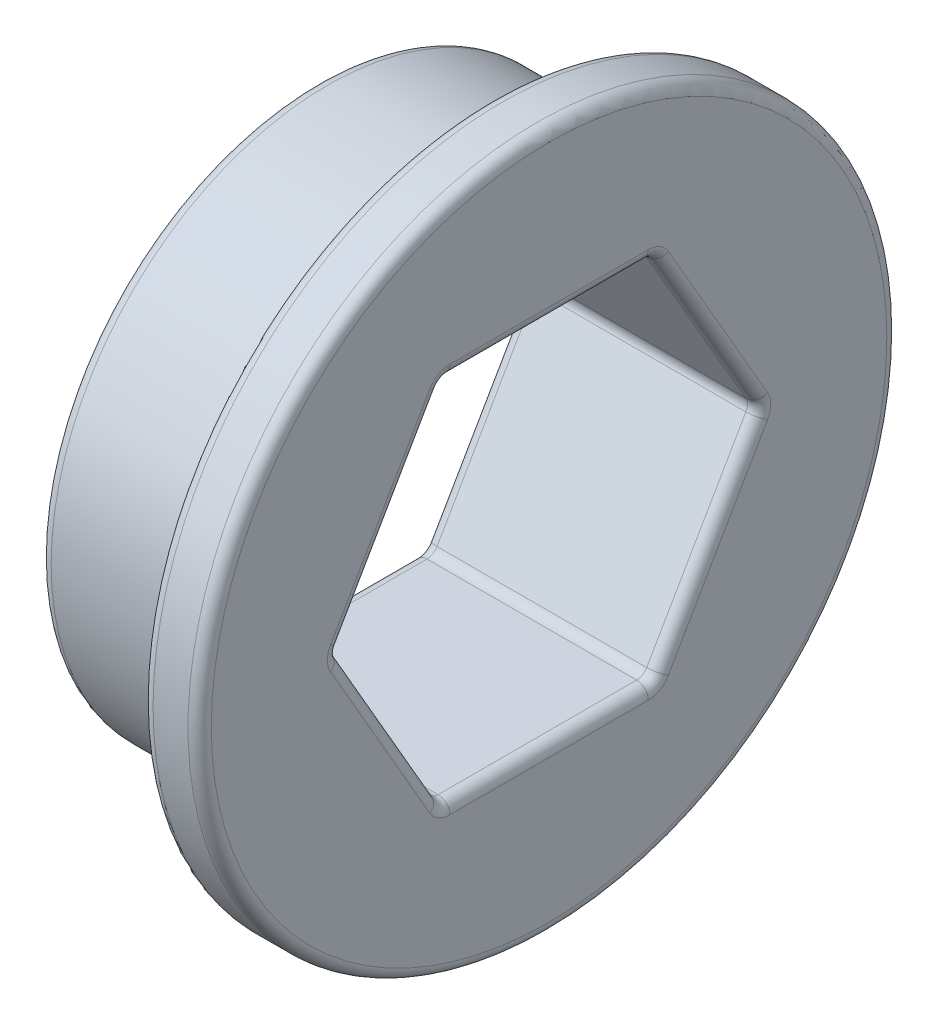
from build123d import *

# Parameters (mm, degrees)
CUT_EXTRUDE1_REACH = 11.381
FILLET1_R          = 0.2


with BuildPart() as part:
    # Sketch1 → Revolve1 (revolve)
    with BuildSketch(Plane.XY):
        Polygon((-4, 0), (-4, 4.75), (-1, 4.75), (-1, 6), (0, 6), (0, 0), align=None)
    revolve(axis=Axis((0, 0, 0), (-1, 0, 0)))

    # Sketch2 → Cut-Extrude1 (cut, up to next)
    with BuildSketch(Plane(origin=(0, 0, 0), x_dir=(0, 0, -1), z_dir=(1, 0, 0)), mode=Mode.PRIVATE) as cut_extrude1_sk1:
        Polygon((3.637306696, 0), (1.818653348, 3.15), (-1.818653348, 3.15), (-3.637306696, 0), (-1.818653348, -3.15), (1.818653348, -3.15), align=None)
    cut_extrude1_tool1 = extrude(cut_extrude1_sk1.sketch, amount=-CUT_EXTRUDE1_REACH, mode=Mode.PRIVATE) & part.part
    add(cut_extrude1_tool1.solids().sort_by_distance((0, 0, 0))[0], mode=Mode.SUBTRACT)

    # Fillet1
    fillet1_edges = [part.edges().sort_by_distance(p)[0] for p in [
        (0, -6, 0),
        (-1, -6, 0),
        (-1, -4.75, 0),
        (-4, -4.75, 0),
        (-4, 3.15, 0),
        (0, 3.15, 0),
        (-4, -1.575, 2.727980022),
        (-4, -1.575, -2.727980022),
        (0, -1.575, -2.727980022),
        (0, -1.575, 2.727980022),
        (-4, 1.575, -2.727980022),
        (-2, 3.15, -1.818653348),
        (0, 1.575, -2.727980022),
        (-2, 0, -3.637306696),
        (-4, 1.575, 2.727980022),
        (-2, 0, 3.637306696),
        (0, 1.575, 2.727980022),
        (-2, 3.15, 1.818653348),
        (-4, -3.15, 0),
        (-2, -3.15, -1.818653348),
        (0, -3.15, 0),
        (-2, -3.15, 1.818653348),
    ]]
    fillet(fillet1_edges, radius=FILLET1_R)


solid = part.part
